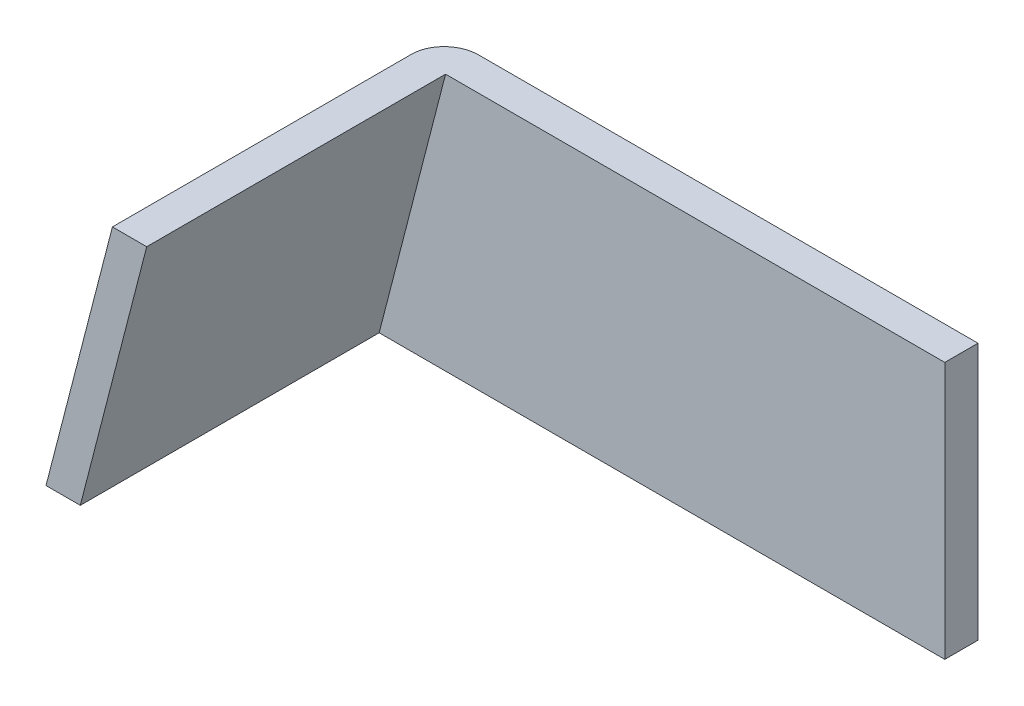
from build123d import *

# Parameters (mm, degrees)
BASE_FLANGE5_DEPTH       = 3.175
EDGE_FLANGE4_START       = -37.332955736
EDGE_FLANGE4_DEPTH       = 25.4
BOSS_EXTRUDE3_DEPTH      = 28.575
BOSS_EXTRUDE3_DEPTH_BACK = 5.08
CUT_EXTRUDE4_DEPTH       = 34.925
CUT_EXTRUDE4_DEPTH_BACK  = 5.588
CUT_EXTRUDE7_DEPTH       = 33.274
CUT_EXTRUDE7_DEPTH_BACK  = 9.779


# Read off the part's stored shape, not the designer's step: Edge-Flange4
# Sheet-metal steps are written as plain solids
with BuildPart() as part:
    # Sketch13 → Base-Flange5 (new body)
    with BuildSketch(Plane.XY):
        Polygon((-47.732145582, 0), (0, 0), (0, -24.593455331), (-54.08210266, -24.593455331), align=None)
    extrude(amount=-BASE_FLANGE5_DEPTH)

    # Edge-Flange4 outline → Edge-Flange4 (add)
    with BuildSketch(Plane(origin=(0, 0, 0), x_dir=(0.9682462728649326, -0.24999831016062188, 0), z_dir=(0.24999831016062188, 0.9682462728649326, 0)).offset(EDGE_FLANGE4_START)):
        with BuildLine():
            Line((-46.216472056, -28.575), (-46.216472056, 3.175))
            ThreePointArc((-46.216472056, 3.175), (-48.461536086, 2.24506403), (-49.391472056, 0))
            Line((-49.391472056, 0), (-49.391472056, -28.575))
            Line((-49.391472056, -28.575), (-46.216472056, -28.575))
        make_face()
    extrude(amount=EDGE_FLANGE4_DEPTH)

    # Sketch50 → Boss-Extrude3 (add, two sides: drawn at the far end of the back side and taken through both)
    with BuildSketch(Plane.XY.offset(-BOSS_EXTRUDE3_DEPTH_BACK)):
        Polygon((-54.08210266, -24.593455331), (-57.156284576, -23.799710696), (-57.361227082, -24.593455331), align=None)
    extrude(amount=BOSS_EXTRUDE3_DEPTH + BOSS_EXTRUDE3_DEPTH_BACK)

    # Sketch51 → Cut-Extrude4 (cut, two sides: drawn at the far end of the back side and taken through both)
    with BuildSketch(Plane.XY.offset(-CUT_EXTRUDE4_DEPTH_BACK)):
        Polygon((-47.732145582, 0), (-51.011270004, 0), (-50.806327498, 0.793744635), align=None)
    extrude(amount=CUT_EXTRUDE4_DEPTH + CUT_EXTRUDE4_DEPTH_BACK, mode=Mode.SUBTRACT)

    # Sketch56 → Cut-Extrude7 (cut, two sides: drawn at the far end of the back side and taken through both)
    with BuildSketch(Plane(origin=(-9.298174, -36.122285036, -0.026223985), x_dir=(0.9684252131455058, -0.24928299754212324, 0.0032547934643607206), z_dir=(0.24928204027092418, 0.9684306738770053, 0.0007030593821182495)).offset(-CUT_EXTRUDE7_DEPTH_BACK)):
        with BuildLine():
            Line((-49.435258201, 4.892901472), (-46.260275882, 4.90323379))
            Line((-46.260275882, 4.90323379), (-46.235347228, 3.016163107))
            ThreePointArc((-46.235347228, 3.016163107), (-48.4905831, 2.0739806), (-49.418723851, -0.187070364))
            Line((-49.418723851, -0.187070364), (-50.079202572, -0.187070364))
            Line((-50.079202572, -0.187070364), (-50.079202572, 4.892901472))
            Line((-50.079202572, 4.892901472), (-49.435258201, 4.892901472))
        make_face()
    extrude(amount=CUT_EXTRUDE7_DEPTH + CUT_EXTRUDE7_DEPTH_BACK, mode=Mode.SUBTRACT)


solid = part.part
